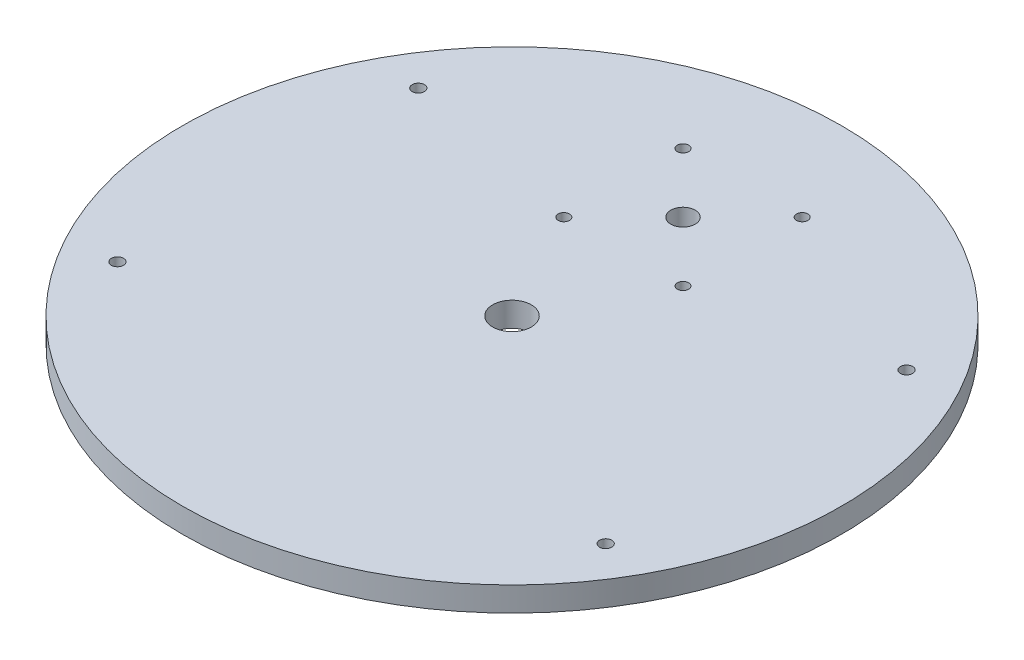
from build123d import *

# Parameters (mm, degrees)
SKETCH1_R           = 85.725
BOSS_EXTRUDE1_DEPTH = 6.35
CUT_EXTRUDE1_REACH  = 123.4
SKETCH2_R           = 1.5875
CUT_EXTRUDE2_REACH  = 123.4
SKETCH3_R           = 3.175
CUT_EXTRUDE3_REACH  = 123.4
SKETCH5_R           = 1.4732
CENTER_HOLE_REACH   = 123.4
SKETCH6_R           = 5.0165


with BuildPart() as part:
    # Sketch1 → Boss-Extrude1 (new body)
    with BuildSketch(Plane(origin=(0, 0, 0), x_dir=(1, 0, 0), z_dir=(0, 1, 0))):
        Circle(SKETCH1_R)
    extrude(amount=BOSS_EXTRUDE1_DEPTH)

    # Sketch2 → Cut-Extrude1 (cut, up to next)
    with BuildSketch(Plane(origin=(0, 6.35, 0), x_dir=(1, 0, 0), z_dir=(0, 1, 0)), mode=Mode.PRIVATE) as cut_extrude1_sk1:
        with Locations((-63.5, 39.13251)):
            Circle(SKETCH2_R)
    cut_extrude1_tool1 = extrude(cut_extrude1_sk1.sketch, amount=-CUT_EXTRUDE1_REACH, mode=Mode.PRIVATE) & part.part
    # Sketch2 → Cut-Extrude1 (cut, up to next)
    with BuildSketch(Plane(origin=(0, 6.35, 0), x_dir=(1, 0, 0), z_dir=(0, 1, 0)), mode=Mode.PRIVATE) as cut_extrude1_sk2:
        with Locations((63.5, 39.13251)):
            Circle(SKETCH2_R)
    cut_extrude1_tool2 = extrude(cut_extrude1_sk2.sketch, amount=-CUT_EXTRUDE1_REACH, mode=Mode.PRIVATE) & part.part
    # Sketch2 → Cut-Extrude1 (cut, up to next)
    with BuildSketch(Plane(origin=(0, 6.35, 0), x_dir=(1, 0, 0), z_dir=(0, 1, 0)), mode=Mode.PRIVATE) as cut_extrude1_sk3:
        with Locations((-63.5, -39.13251)):
            Circle(SKETCH2_R)
    cut_extrude1_tool3 = extrude(cut_extrude1_sk3.sketch, amount=-CUT_EXTRUDE1_REACH, mode=Mode.PRIVATE) & part.part
    # Sketch2 → Cut-Extrude1 (cut, up to next)
    with BuildSketch(Plane(origin=(0, 6.35, 0), x_dir=(1, 0, 0), z_dir=(0, 1, 0)), mode=Mode.PRIVATE) as cut_extrude1_sk4:
        with Locations((63.5, -39.13251)):
            Circle(SKETCH2_R)
    cut_extrude1_tool4 = extrude(cut_extrude1_sk4.sketch, amount=-CUT_EXTRUDE1_REACH, mode=Mode.PRIVATE) & part.part
    add(cut_extrude1_tool1.solids().sort_by_distance((-63.5, 6.35, -39.13251))[0], mode=Mode.SUBTRACT)
    add(cut_extrude1_tool2.solids().sort_by_distance((63.5, 6.35, -39.13251))[0], mode=Mode.SUBTRACT)
    add(cut_extrude1_tool3.solids().sort_by_distance((-63.5, 6.35, 39.13251))[0], mode=Mode.SUBTRACT)
    add(cut_extrude1_tool4.solids().sort_by_distance((63.5, 6.35, 39.13251))[0], mode=Mode.SUBTRACT)

    # Sketch3 → Cut-Extrude2 (cut, up to next)
    with BuildSketch(Plane(origin=(0, 6.35, 0), x_dir=(1, 0, 0), z_dir=(0, 1, 0)), mode=Mode.PRIVATE) as cut_extrude2_sk1:
        with Locations((0, 44.482150941)):
            Circle(SKETCH3_R)
    cut_extrude2_tool1 = extrude(cut_extrude2_sk1.sketch, amount=-CUT_EXTRUDE2_REACH, mode=Mode.PRIVATE) & part.part
    add(cut_extrude2_tool1.solids().sort_by_distance((0, 6.35, -44.482151))[0], mode=Mode.SUBTRACT)

    # Sketch5 → Cut-Extrude3 (cut, up to next)
    with BuildSketch(Plane(origin=(0, 6.35, 0), x_dir=(1, 0, 0), z_dir=(0, 1, 0)), mode=Mode.PRIVATE) as cut_extrude3_sk1:
        with Locations((-15.50035, 59.982500941)):
            Circle(SKETCH5_R)
    cut_extrude3_tool1 = extrude(cut_extrude3_sk1.sketch, amount=-CUT_EXTRUDE3_REACH, mode=Mode.PRIVATE) & part.part
    # Sketch5 → Cut-Extrude3 (cut, up to next)
    with BuildSketch(Plane(origin=(0, 6.35, 0), x_dir=(1, 0, 0), z_dir=(0, 1, 0)), mode=Mode.PRIVATE) as cut_extrude3_sk2:
        with Locations((15.50035, 59.982500941)):
            Circle(SKETCH5_R)
    cut_extrude3_tool2 = extrude(cut_extrude3_sk2.sketch, amount=-CUT_EXTRUDE3_REACH, mode=Mode.PRIVATE) & part.part
    # Sketch5 → Cut-Extrude3 (cut, up to next)
    with BuildSketch(Plane(origin=(0, 6.35, 0), x_dir=(1, 0, 0), z_dir=(0, 1, 0)), mode=Mode.PRIVATE) as cut_extrude3_sk3:
        with Locations((-15.50035, 28.981800941)):
            Circle(SKETCH5_R)
    cut_extrude3_tool3 = extrude(cut_extrude3_sk3.sketch, amount=-CUT_EXTRUDE3_REACH, mode=Mode.PRIVATE) & part.part
    # Sketch5 → Cut-Extrude3 (cut, up to next)
    with BuildSketch(Plane(origin=(0, 6.35, 0), x_dir=(1, 0, 0), z_dir=(0, 1, 0)), mode=Mode.PRIVATE) as cut_extrude3_sk4:
        with Locations((15.50035, 28.981800941)):
            Circle(SKETCH5_R)
    cut_extrude3_tool4 = extrude(cut_extrude3_sk4.sketch, amount=-CUT_EXTRUDE3_REACH, mode=Mode.PRIVATE) & part.part
    add(cut_extrude3_tool1.solids().sort_by_distance((-15.50035, 6.35, -59.982501))[0], mode=Mode.SUBTRACT)
    add(cut_extrude3_tool2.solids().sort_by_distance((15.50035, 6.35, -59.982501))[0], mode=Mode.SUBTRACT)
    add(cut_extrude3_tool3.solids().sort_by_distance((-15.50035, 6.35, -28.981801))[0], mode=Mode.SUBTRACT)
    add(cut_extrude3_tool4.solids().sort_by_distance((15.50035, 6.35, -28.981801))[0], mode=Mode.SUBTRACT)

    # Sketch6 → center_hole (cut, up to next)
    with BuildSketch(Plane(origin=(0, 6.35, 0), x_dir=(1, 0, 0), z_dir=(0, 1, 0)), mode=Mode.PRIVATE) as center_hole_sk1:
        Circle(SKETCH6_R)
    center_hole_tool1 = extrude(center_hole_sk1.sketch, amount=-CENTER_HOLE_REACH, mode=Mode.PRIVATE) & part.part
    add(center_hole_tool1.solids().sort_by_distance((0, 6.35, 0))[0], mode=Mode.SUBTRACT)


solid = part.part
